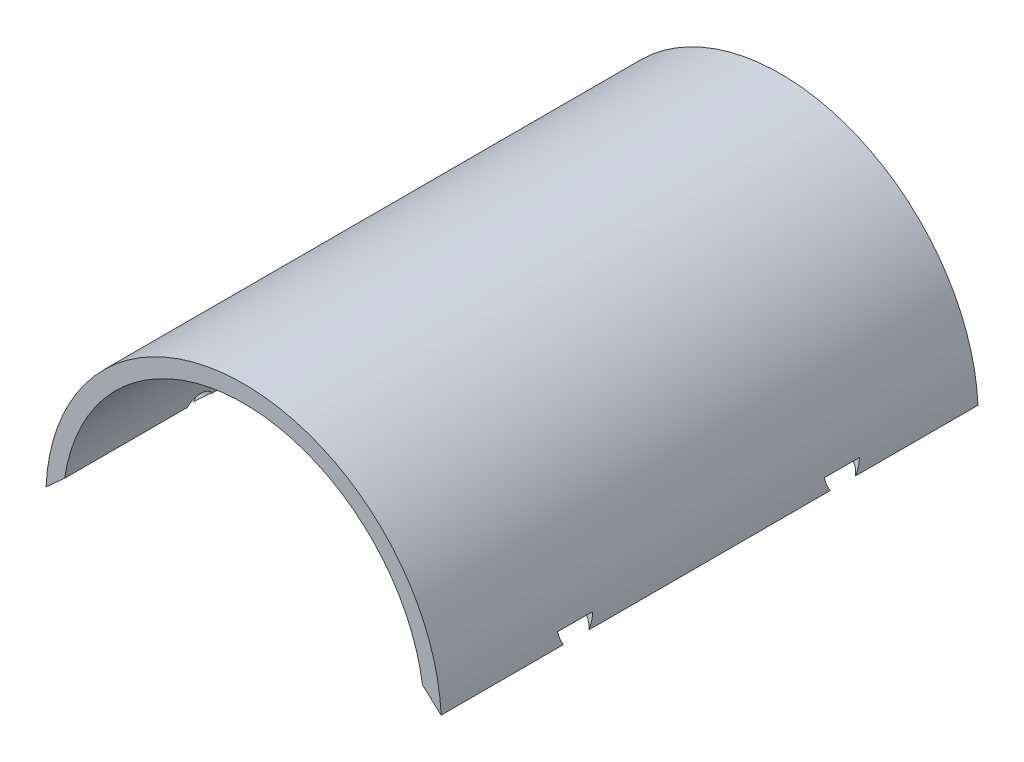
from build123d import *

# Parameters (mm, degrees)
BOSS_EXTRUDE1_DEPTH = 120.65
SKETCH2_R           = 4
CUT_EXTRUDE1_DEPTH  = 2
SKETCH3_R           = 4
CUT_EXTRUDE2_DEPTH  = 2


with BuildPart() as part:
    # Sketch1 → Boss-Extrude1 (new body)
    with BuildSketch(Plane.XY):
        with BuildLine():
            Line((-40.203883769, 5.937788296), (-44.399042974, 2.127788296))
            ThreePointArc((-44.399042974, 2.127788296), (0, 44.45), (44.399042974, 2.127788296))
            Line((44.399042974, 2.127788296), (40.203883769, 5.937788296))
            ThreePointArc((40.203883769, 5.937788296), (0, 40.64), (-40.203883769, 5.937788296))
        make_face()
    extrude(amount=BOSS_EXTRUDE1_DEPTH)

    # Sketch2 → Cut-Extrude1 (cut)
    with BuildSketch(Plane(origin=(-21.127225221, 23.263011377, 0), x_dir=(0.7402720771062569, 0.6723074087475075, 0), z_dir=(0.6723074087475075, -0.7402720771062569, 0))):
        with Locations((-28.603318705, 90.297)):
            Circle(SKETCH2_R)
        with Locations((-28.603318705, 30.353)):
            Circle(SKETCH2_R)
    extrude(amount=-CUT_EXTRUDE1_DEPTH, mode=Mode.SUBTRACT)

    # Sketch3 → Cut-Extrude2 (cut)
    with BuildSketch(Plane(origin=(21.127225221, 23.263011377, 0), x_dir=(0.7402720771062569, -0.6723074087475075, 0), z_dir=(-0.6723074087475075, -0.7402720771062569, 0))):
        with Locations((28.603318705, 90.297)):
            Circle(SKETCH3_R)
        with Locations((28.603318705, 30.353)):
            Circle(SKETCH3_R)
    extrude(amount=-CUT_EXTRUDE2_DEPTH, mode=Mode.SUBTRACT)


solid = part.part
